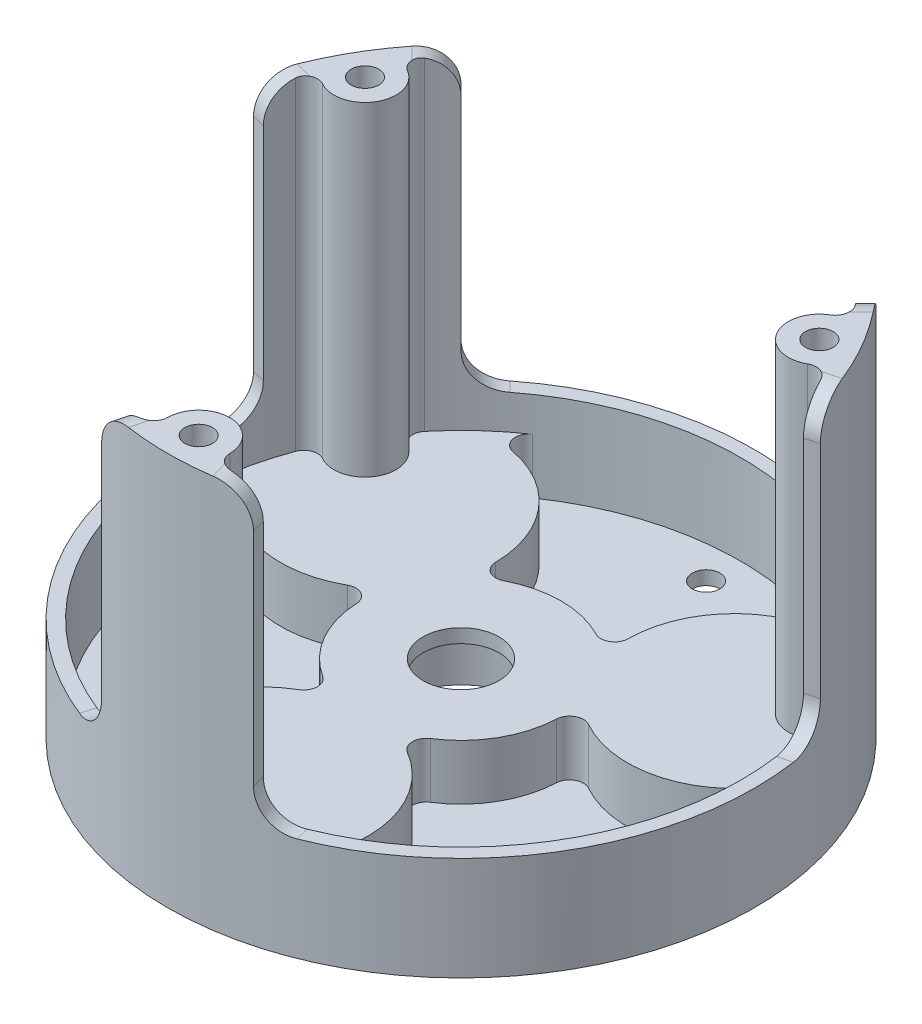
from build123d import *
from build123d.topology import SkipClean

# Parameters (mm, degrees)
SKETCH1_R           = 42.5
BOSS_EXTRUDE1_DEPTH = 1
BOSS_EXTRUDE2_START = 9
BOSS_EXTRUDE2_DEPTH = 9
BOSS_EXTRUDE3_START = 55
SKETCH8_R           = 42.5
SKETCH8_R_2         = 40.5
BOSS_EXTRUDE3_DEPTH = 55
CUT_EXTRUDE4_START  = -2
SKETCH11_R          = 5
CUT_EXTRUDE4_DEPTH  = 10
SKETCH3_R           = 9.5
CUT_EXTRUDE2_DEPTH  = 8
SKETCH14_R          = 2
CUT_EXTRUDE5_DEPTH  = 82.470853684
SKETCH16_R          = 5.5
CUT_EXTRUDE7_DEPTH  = 78.546760087
FILLET4_R           = 2
CUT_EXTRUDE8_DEPTH  = 42
BOSS_EXTRUDE4_START = 47
SKETCH18_R          = 2
BOSS_EXTRUDE4_DEPTH = 47
FILLET5_R           = 2
FILLET6_R           = 5
FILLET7_R           = 5


with BuildPart() as part:
    # Sketch1 → Boss-Extrude1 (new, symmetric)
    with BuildSketch(Plane(origin=(0, 0, 0), x_dir=(1, 0, 0), z_dir=(0, 1, 0))):
        with Locations(Location((0, 0, 0), (0, 0, 270))):
            Circle(SKETCH1_R)
    extrude(amount=BOSS_EXTRUDE1_DEPTH, both=True)

    # Sketch7 → Boss-Extrude2 (add)
    with SkipClean():  # the faces are left unmerged after this step: merging them gives an invalid solid
        with BuildSketch(Plane(origin=(0, 0, 0), x_dir=(1, 0, 0), z_dir=(0, 1, 0)).offset(BOSS_EXTRUDE2_START)):
            with BuildLine():
                ThreePointArc((-9.200212243, -41.492241379), (0, -42.5), (9.200212243, -41.492241379))
                ThreePointArc((9.200212243, -41.492241379), (15.231021227, -26.047714042), (3.866442163, -13.975))
                ThreePointArc((3.866442163, -13.975), (12.557368355, -7.25), (14.035926099, 3.639062865))
                ThreePointArc((14.035926099, 3.639062865), (30.173492685, -0.166594287), (40.533441216, 12.778503167))
                ThreePointArc((40.533441216, 12.778503167), (36.806079661, 21.25), (31.333228973, 28.713738213))
                ThreePointArc((31.333228973, 28.713738213), (14.942471458, 26.21430833), (10.169483936, 10.335937135))
                ThreePointArc((10.169483936, 10.335937135), (0, 14.5), (-10.169483936, 10.335937135))
                ThreePointArc((-10.169483936, 10.335937135), (-14.942471458, 26.21430833), (-31.333228973, 28.713738213))
                ThreePointArc((-31.333228973, 28.713738213), (-36.806079661, 21.25), (-40.533441216, 12.778503167))
                ThreePointArc((-40.533441216, 12.778503167), (-30.173492685, -0.166594287), (-14.035926099, 3.639062865))
                ThreePointArc((-14.035926099, 3.639062865), (-12.557368355, -7.25), (-3.866442163, -13.975))
                ThreePointArc((-3.866442163, -13.975), (-15.231021227, -26.047714042), (-9.200212243, -41.492241379))
            make_face()
        extrude(amount=-BOSS_EXTRUDE2_DEPTH)

    # Sketch8 → Boss-Extrude3 (add)
    with SkipClean():  # the faces are left unmerged after this step: merging them gives an invalid solid
        with BuildSketch(Plane(origin=(0, 1, 0), x_dir=(1, 0, 0), z_dir=(0, 1, 0)).offset(BOSS_EXTRUDE3_START)):
            with Locations(Location((0, 0, 0), (0, 0, 270))):
                Circle(SKETCH8_R)
            with Locations(Location((0, 0, 0), (0, 0, 47.478176567))):
                Circle(SKETCH8_R_2, mode=Mode.SUBTRACT)
        extrude(amount=-BOSS_EXTRUDE3_DEPTH)
    add(part.part.scale(1), mode=Mode.REPLACE)  # the faces are merged on a copy

    # Sketch11 → Cut-Extrude4 (cut)
    with BuildSketch(Plane(origin=(0, 9, 0), x_dir=(1, 0, 0), z_dir=(0, 1, 0)).offset(CUT_EXTRUDE4_START)):
        with Locations(Location((-25.11473671, 14.5, 0), (0, 0, 270))):
            Circle(SKETCH11_R)
        with Locations(Location((0, -29, 0), (0, 0, 270))):
            Circle(SKETCH11_R)
        with Locations(Location((25.11473671, 14.5, 0), (0, 0, 270))):
            Circle(SKETCH11_R)
    extrude(amount=-CUT_EXTRUDE4_DEPTH, mode=Mode.SUBTRACT)

    # Sketch3 → Cut-Extrude2 (cut)
    with BuildSketch(Plane.XZ.offset(1)):
        with Locations(Location((0, 0, 0), (0, 0, 270))):
            Circle(SKETCH3_R)
    extrude(amount=-CUT_EXTRUDE2_DEPTH, mode=Mode.SUBTRACT)

    # Sketch14 → Cut-Extrude5 (cut, through all)
    with BuildSketch(Plane(origin=(0, 1, 0), x_dir=(1, 0, 0), z_dir=(0, 1, 0))):
        with Locations(Location((0, 35.5, 0), (0, 0, 270))):
            Circle(SKETCH14_R)
        with Locations(Location((30.743901834, -17.75, 0), (0, 0, 270))):
            Circle(SKETCH14_R)
        with Locations(Location((-30.743901834, -17.75, 0), (0, 0, 270))):
            Circle(SKETCH14_R)
    extrude(amount=-CUT_EXTRUDE5_DEPTH, mode=Mode.SUBTRACT)

    # Sketch16 → Cut-Extrude7 (cut, through all)
    with BuildSketch(Plane.XZ.offset(-7)):
        with Locations(Location((0, 0, 0), (0, 0, 270))):
            Circle(SKETCH16_R)
    extrude(amount=-CUT_EXTRUDE7_DEPTH, mode=Mode.SUBTRACT)

    # Fillet4
    # the kernel refuses this fillet: 2 mm, written as the material it adds along each edge
    with BuildSketch(Plane(origin=(3.866442163, 9, 13.975), x_dir=(0.9241946565882526, 0, 0.38192176781864856), z_dir=(0, -1, 0)), Plane(origin=(10.169483936, 9, -10.335937135), x_dir=(-0.13134337510491473, 0, -0.9913369345565863), z_dir=(0, -1, 0)), Plane(origin=(-14.035926099, 9, -3.639062865), x_dir=(-0.7928512814833386, 0, 0.6094151667379372), z_dir=(0, -1, 0))) as fillet4_piece_1:
        with BuildLine():
            CenterArc((4.609156119, -1.980430422), FILLET4_R, 98.021731435, 116.954957983)
            ThreePointArc((2.970385451, -3.126916662), (1.602101105, -1.452402302), (0, 0))
            ThreePointArc((0, 0), (2.165029374, -0.151806197), (4.330058749, 0))
        make_face()
    extrude(amount=8)
    with BuildSketch(Plane(origin=(14.035926099, 9, -3.639062865), x_dir=(0.792851281483338, 0, 0.6094151667379377), z_dir=(0, -1, 0)), Plane(origin=(-10.169483936, 9, -10.335937135), x_dir=(0.1313433751049141, 0, -0.9913369345565866), z_dir=(0, -1, 0)), Plane(origin=(-3.866442163, 9, 13.975), x_dir=(-0.9241946565882523, 0, 0.3819217678186494), z_dir=(0, -1, 0))) as fillet4_piece_2:
        with BuildLine():
            CenterArc((4.609156119, 1.980430422), FILLET4_R, 145.023310581, 116.954957983)
            ThreePointArc((2.970385451, 3.126916662), (1.602101105, 1.452402302), (0, 0))
            ThreePointArc((0, 0), (2.165029374, 0.151806197), (4.330058749, 0))
        make_face()
    extrude(amount=8)
    with BuildSketch(Plane(origin=(-27.372774719, 1, -29.849308269), x_dir=(0.7821590944237234, 0, -0.623078767901989), z_dir=(0, 1, 0)), Plane(origin=(39.536646606, 1, -8.780864144), x_dir=(0.14852249434996673, 0, 0.9889090295229709), z_dir=(0, 1, 0)), Plane(origin=(27.372774719, 9, -29.849308269), x_dir=(-0.7821590944238648, 0, -0.6230787679018116), z_dir=(0, -1, 0)), Plane(origin=(-12.163871887, 1, 38.630172414), x_dir=(-0.9306815887736916, 0, -0.3658302616209833), z_dir=(0, 1, 0))) as fillet4_piece_3:
        with BuildLine():
            CenterArc((5.48395464, -1.995175441), FILLET4_R, 86.019489215, 134.664019142)
            ThreePointArc((3.967310639, -3.298935761), (2.121758697, -1.48338432), (0, 0))
            ThreePointArc((0, 0), (2.811394467, 0.097697329), (5.622788935, 0))
        make_face()
    extrude(amount=8)
    with BuildSketch(Plane(origin=(-39.536646606, 1, -8.780864144), x_dir=(-0.14852249434996878, 0, 0.9889090295229706), z_dir=(0, 1, 0)), Plane(origin=(12.163871887, 1, 38.630172414), x_dir=(0.9306815887736921, 0, -0.365830261620982), z_dir=(0, 1, 0))) as fillet4_piece_4:
        with BuildLine():
            CenterArc((5.48395464, 1.995175441), FILLET4_R, 139.316491643, 134.664019142)
            ThreePointArc((3.967310639, 3.298935761), (2.121758697, 1.48338432), (0, 0))
            ThreePointArc((0, 0), (2.811394467, -0.097697329), (5.622788935, 0))
        make_face()
    extrude(amount=8)

    # Sketch17 → Cut-Extrude8 (cut)
    with BuildSketch(Plane(origin=(0, 56, 0), x_dir=(1, 0, 0), z_dir=(0, 1, 0))):
        with BuildLine():
            Line((0, 42.5), (0, 0))
            Line((0, 0), (30.0520382, 30.0520382))
            ThreePointArc((30.0520382, 30.0520382), (16.264045876, 39.264880132), (0, 42.5))
        make_face()
        with BuildLine():
            Line((-30.0520382, 30.0520382), (0, 0))
            Line((0, 0), (0, 42.5))
            ThreePointArc((0, 42.5), (-16.264045876, 39.264880132), (-30.0520382, 30.0520382))
        make_face()
        with BuildLine():
            Line((41.051847617, 10.999809417), (0, 0))
            Line((0, 0), (10.999809417, -41.051847617))
            ThreePointArc((10.999809417, -41.051847617), (36.806079661, -21.25), (41.051847617, 10.999809417))
        make_face()
        with BuildLine():
            Line((-10.999809417, -41.051847617), (0, 0))
            Line((0, 0), (-41.051847617, 10.999809417))
            ThreePointArc((-41.051847617, 10.999809417), (-36.806079661, -21.25), (-10.999809417, -41.051847617))
        make_face()
    extrude(amount=-CUT_EXTRUDE8_DEPTH, mode=Mode.SUBTRACT)

    # Sketch18 → Boss-Extrude4 (add)
    # profile 1 of 6: a face of its own
    with BuildSketch(Plane(origin=(0, 9, 0), x_dir=(1, 0, 0), z_dir=(0, 1, 0)).offset(BOSS_EXTRUDE4_START)):
        with BuildLine():
            ThreePointArc((-36.843689341, 16.816437071), (-31.781192757, 14.643610555), (-28.408965344, 19))
            ThreePointArc((-28.408965344, 19), (-29.754090912, 22.208857635), (-32.985306375, 23.499352403))
            ThreePointArc((-32.985306375, 23.499352403), (-35.074028853, 20.25), (-36.843689341, 16.816437071))
        make_face()
        with Locations(Location((-32.908965344, 19, 0), (0, 0, 270))):
            Circle(SKETCH18_R, mode=Mode.SUBTRACT)
    # profile 2 of 6: a face of its own
    with BuildSketch(Plane(origin=(0, 9, 0), x_dir=(1, 0, 0), z_dir=(0, 1, 0)).offset(BOSS_EXTRUDE4_START)):
        with BuildLine():
            ThreePointArc((36.843689341, 16.816437071), (35.074028853, 20.25), (32.985306375, 23.499352403))
            ThreePointArc((32.985306375, 23.499352403), (29.011851027, 16.75), (36.843689341, 16.816437071))
        make_face()
        with Locations(Location((32.908965344, 19, 0), (0, 0, 270))):
            Circle(SKETCH18_R, mode=Mode.SUBTRACT)
    # profile 3 of 6: a face of its own
    with BuildSketch(Plane(origin=(0, 9, 0), x_dir=(1, 0, 0), z_dir=(0, 1, 0)).offset(BOSS_EXTRUDE4_START)):
        with BuildLine():
            ThreePointArc((4.5, -38), (3.181980515, -34.818019485), (0, -33.5))
            Line((0, -33.5), (0, -36))
            ThreePointArc((0, -36), (1.414213562, -36.585786438), (2, -38))
            ThreePointArc((2, -38), (1.414213562, -39.414213562), (0, -40))
            Line((0, -40), (0, -40.5))
            ThreePointArc((0, -40.5), (1.931388919, -40.453921155), (3.858382966, -40.315789474))
            ThreePointArc((3.858382966, -40.315789474), (4.336630221, -39.201515013), (4.5, -38))
        make_face()
    # profile 4 of 6: a face of its own
    with BuildSketch(Plane(origin=(0, 9, 0), x_dir=(1, 0, 0), z_dir=(0, 1, 0)).offset(BOSS_EXTRUDE4_START)):
        with BuildLine():
            Line((0, -36), (0, -33.5))
            ThreePointArc((0, -33.5), (-3.91606005, -35.783138777), (-3.858382966, -40.315789474))
            ThreePointArc((-3.858382966, -40.315789474), (-1.931388919, -40.453921155), (0, -40.5))
            Line((0, -40.5), (0, -40))
            ThreePointArc((0, -40), (-2, -38), (0, -36))
        make_face()
    # profile 5 of 6: a face of its own
    with BuildSketch(Plane(origin=(0, 9, 0), x_dir=(1, 0, 0), z_dir=(0, 1, 0)).offset(BOSS_EXTRUDE4_START)):
        with BuildLine():
            ThreePointArc((4.5, -38), (3.181980515, -34.818019485), (0, -33.5))
            Line((0, -33.5), (0, -36))
            ThreePointArc((0, -36), (1.414213562, -36.585786438), (2, -38))
            ThreePointArc((2, -38), (1.414213562, -39.414213562), (0, -40))
            Line((0, -40), (0, -40.5))
            ThreePointArc((0, -40.5), (1.931388919, -40.453921155), (3.858382966, -40.315789474))
            ThreePointArc((3.858382966, -40.315789474), (4.336630221, -39.201515013), (4.5, -38))
        make_face()
    # profile 6 of 6: a face of its own
    with BuildSketch(Plane(origin=(0, 9, 0), x_dir=(1, 0, 0), z_dir=(0, 1, 0)).offset(BOSS_EXTRUDE4_START)):
        with BuildLine():
            Line((0, -36), (0, -33.5))
            ThreePointArc((0, -33.5), (-3.91606005, -35.783138777), (-3.858382966, -40.315789474))
            ThreePointArc((-3.858382966, -40.315789474), (-1.931388919, -40.453921155), (0, -40.5))
            Line((0, -40.5), (0, -40))
            ThreePointArc((0, -40), (-2, -38), (0, -36))
        make_face()
    extrude(amount=-BOSS_EXTRUDE4_DEPTH)

    # Fillet5
    fillet5_edges = [part.edges().sort_by_distance(p)[0] for p in [
        (-32.985306375, 32.5, -23.499352403),
        (-36.843689341, 32.5, -16.816437071),
        (36.843689341, 32.5, -16.816437071),
        (32.985306375, 32.5, -23.499352403),
        (3.858382966, 32.5, 40.315789474),
        (-3.858382966, 32.5, 40.315789474),
    ]]
    fillet(fillet5_edges, radius=FILLET5_R)

    # Fillet6
    fillet6_edges = [part.edges().sort_by_distance(p)[0] for p in [
        (-29.344931419, 14, -29.344931419),
        (29.344931419, 14, -29.344931419),
        (40.085921791, 14, -10.740990372),
        (10.740990372, 14, 40.085921791),
        (-10.740990372, 14, 40.085921791),
        (-40.085921791, 14, -10.740990372),
    ]]
    fillet(fillet6_edges, radius=FILLET6_R)

    # Fillet7
    fillet7_edges = [part.edges().sort_by_distance(p)[0] for p in [
        (-29.344931419, 56, -29.344931419),
        (29.344931419, 56, -29.344931419),
        (10.740990372, 56, 40.085921791),
        (40.085921791, 56, -10.740990372),
        (-40.085921791, 56, -10.740990372),
        (-10.740990372, 56, 40.085921791),
    ]]
    fillet(fillet7_edges, radius=FILLET7_R)


solid = part.part
